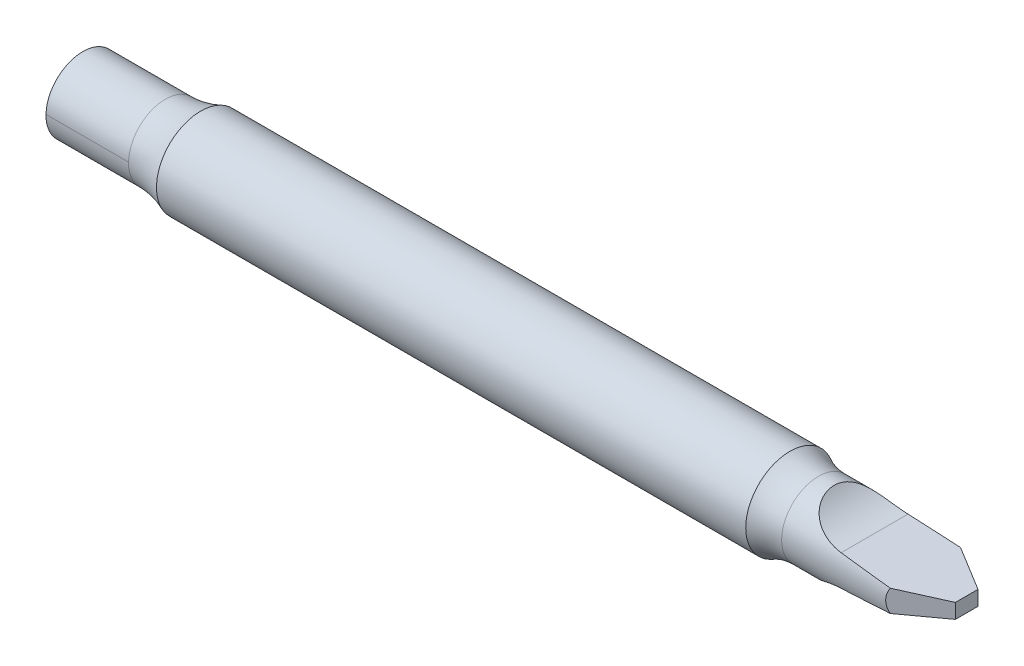
from build123d import *

# Parameters (mm, degrees)
SKETCH1_R           = 15.875
BASE_EXTRUDE_DEPTH  = 50.8
SKETCH2_R           = 19.05
BOSS_EXTRUDE1_DEPTH = 254
SKETCH3_R           = 15.875
BOSS_EXTRUDE2_DEPTH = 76.2
FILLET1_R           = 25.4
FILLET2_R           = 38.1
CUT_EXTRUDE1_DEPTH  = 38.1
CUT_EXTRUDE2_DEPTH  = 38.1


with BuildPart() as part:
    # Sketch1 → Base-Extrude (new body)
    with BuildSketch(Plane(origin=(0, 0, 0), x_dir=(0, 0, -1), z_dir=(1, 0, 0))):
        Circle(SKETCH1_R)
    extrude(amount=BASE_EXTRUDE_DEPTH)

    # Sketch2 → Boss-Extrude1 (add)
    with BuildSketch(Plane(origin=(50.8, 0, 0), x_dir=(0, 0, -1), z_dir=(1, 0, 0))):
        Circle(SKETCH2_R)
    extrude(amount=BOSS_EXTRUDE1_DEPTH)

    # Sketch3 → Boss-Extrude2 (add)
    with BuildSketch(Plane(origin=(304.8, 0, 0), x_dir=(0, 0, -1), z_dir=(1, 0, 0))):
        Circle(SKETCH3_R)
    extrude(amount=BOSS_EXTRUDE2_DEPTH)

    # Fillet1
    # the kernel refuses this fillet: 25.4 mm, written as the material it adds along each edge
    with BuildSketch(Plane(origin=(304.8, 0, 0), x_dir=(0, 0, -1), z_dir=(0, -1, 0))) as fillet1_piece_1:
        with BuildLine():
            CenterArc((41.275, 12.296722124), FILLET1_R, 180, 28.955024372)
            Line((15.875, 12.296722124), (15.367, 12.296722124))
            Line((15.367, 12.296722124), (15.367, 0))
            Line((15.367, 0), (15.875, -0.508))
            ThreePointArc((15.875, -0.508), (17.4625, -0.508), (18.6055, -0.245934442))
            Line((18.6055, -0.245934442), (19.05, 0))
        make_face()
    revolve(axis=Axis((304.8, 0, 0), (1, 0, 0)))

    # Fillet2
    # the kernel refuses this fillet: 38.1 mm, written as the material it adds along each edge
    with BuildSketch(Plane(origin=(50.8, 0, 0), x_dir=(0, 0, -1), z_dir=(0, -1, 0))) as fillet2_piece_1:
        with BuildLine():
            CenterArc((53.975, -15.226765087), FILLET2_R, 156.443535691, 23.556464309)
            Line((15.875, -15.226765087), (15.113, -15.226765087))
            Line((15.113, -15.226765087), (15.113, 0))
            Line((15.113, 0), (15.875, 0.762))
            ThreePointArc((15.875, 0.762), (17.4625, 0.762), (18.3515, 0.304535302))
            Line((18.3515, 0.304535302), (19.05, 0))
        make_face()
    revolve(axis=Axis((50.8, 0, 0), (1, 0, 0)))

    # Sketch4 → Cut-Extrude1 (cut, symmetric)
    with BuildSketch(Plane.XY):
        with BuildLine():
            Line((341.301045638, 6.648208461), (381, 3.175))
            Line((381, 3.175), (381, 15.875))
            Line((381, 15.875), (323.85, 15.875))
            ThreePointArc((323.85, 15.875), (331.642512816, 9.496960468), (341.301045638, 6.648208461))
        make_face()
    cut_extrude1 = extrude(amount=CUT_EXTRUDE1_DEPTH, both=True, mode=Mode.SUBTRACT)

    # Mirror1: Cut-Extrude1 across plane
    add(cut_extrude1.mirror(Plane.ZX), mode=Mode.SUBTRACT)

    # Sketch5 → Cut-Extrude2 (cut, symmetric)
    with BuildSketch(Plane(origin=(0, 0, 0), x_dir=(1, 0, 0), z_dir=(0, 1, 0))):
        Polygon((361.95, 15.875), (381, 4.876477372), (381, 15.875), align=None)
    cut_extrude2 = extrude(amount=CUT_EXTRUDE2_DEPTH, both=True, mode=Mode.SUBTRACT)

    # Mirror2: Cut-Extrude2 across plane
    add(cut_extrude2.mirror(Plane.XY), mode=Mode.SUBTRACT)


solid = part.part
